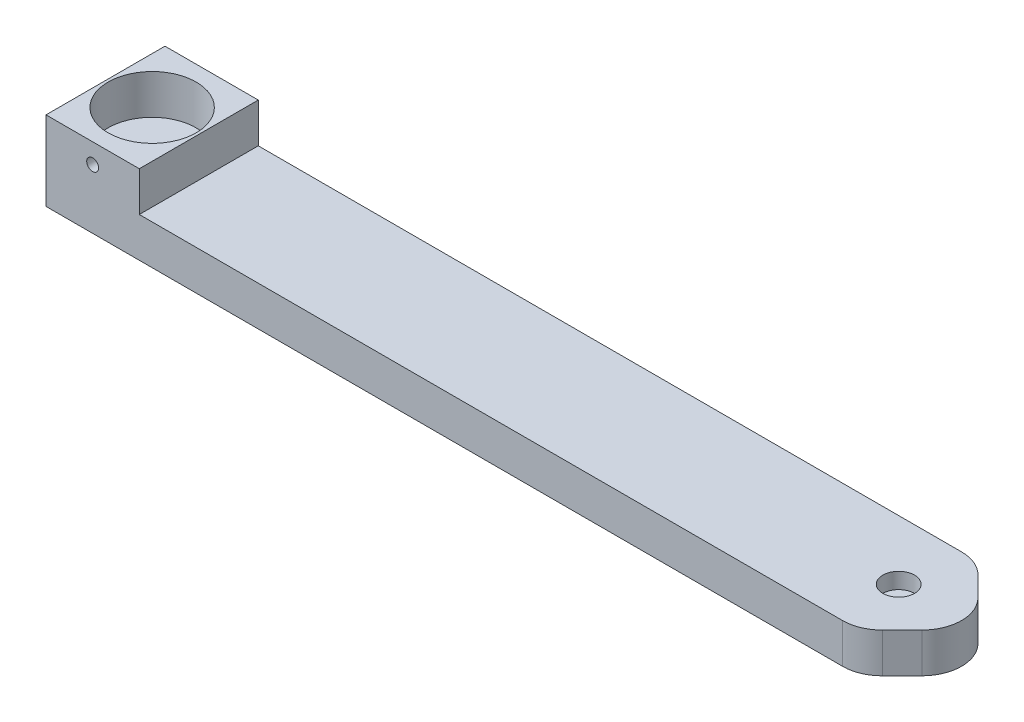
from build123d import *

# Parameters (mm, degrees)
SKETCH1_W           = 220
SKETCH1_H           = 30
BOSS_EXTRUDE1_DEPTH = 10
SKETCH2_W           = 23.523691572
SKETCH2_H           = 30
SKETCH2_R           = 11.1
BOSS_EXTRUDE3_DEPTH = 10
SKETCH6_R           = 1.5
CUT_EXTRUDE2_DEPTH  = 10
SKETCH4_R           = 4
CUT_EXTRUDE3_DEPTH  = 4
SKETCH7_R           = 1.5
CUT_EXTRUDE4_DEPTH  = 14
CUT_EXTRUDE5_DEPTH  = 10
FILLET1_R           = 10


with BuildPart() as part:
    # Sketch1 → Boss-Extrude1 (new body)
    with BuildSketch(Plane(origin=(0, 0, 0), x_dir=(1, 0, 0), z_dir=(0, 1, 0))):
        Rectangle(SKETCH1_W, SKETCH1_H)
    extrude(amount=BOSS_EXTRUDE1_DEPTH)

    # Sketch2 → Boss-Extrude3 (add)
    with BuildSketch(Plane(origin=(0, 10, 0), x_dir=(1, 0, 0), z_dir=(0, 1, 0))):
        with Locations((-98.238154214, 0)):
            Rectangle(SKETCH2_W, SKETCH2_H)
        with Locations((-98.238154214, 0)):
            Circle(SKETCH2_R, mode=Mode.SUBTRACT)
    extrude(amount=BOSS_EXTRUDE3_DEPTH)

    # Sketch6 → Cut-Extrude2 (cut)
    with BuildSketch(Plane.XY.offset(15)):
        with Locations((-98.238154214, 15)):
            Circle(SKETCH6_R)
    extrude(amount=-CUT_EXTRUDE2_DEPTH, mode=Mode.SUBTRACT)

    # Sketch4 → Cut-Extrude3 (cut)
    with BuildSketch(Plane(origin=(0, 10, 0), x_dir=(1, 0, 0), z_dir=(0, 1, 0))):
        with Locations((90, 0)):
            Circle(SKETCH4_R)
    extrude(amount=-CUT_EXTRUDE3_DEPTH, mode=Mode.SUBTRACT)

    # Sketch7 → Cut-Extrude4 (cut)
    with BuildSketch(Plane(origin=(0, 6, 0), x_dir=(1, 0, 0), z_dir=(0, 1, 0))):
        with Locations((90, 0)):
            Circle(SKETCH7_R)
    extrude(amount=-CUT_EXTRUDE4_DEPTH, mode=Mode.SUBTRACT)

    # Sketch8 → Cut-Extrude5 (cut)
    with BuildSketch(Plane(origin=(0, 10, 0), x_dir=(1, 0, 0), z_dir=(0, 1, 0))):
        Polygon((110, 15), (95, 15), (110, 0), align=None)
        Polygon((110, -15), (110, 0), (95, -15), align=None)
    extrude(amount=-CUT_EXTRUDE5_DEPTH, mode=Mode.SUBTRACT)

    # Fillet1
    fillet1_edges = [part.edges().sort_by_distance(p)[0] for p in [
        (95, 5, -15),
        (110, 5, 0),
        (95, 5, 15),
    ]]
    fillet(fillet1_edges, radius=FILLET1_R)


solid = part.part
